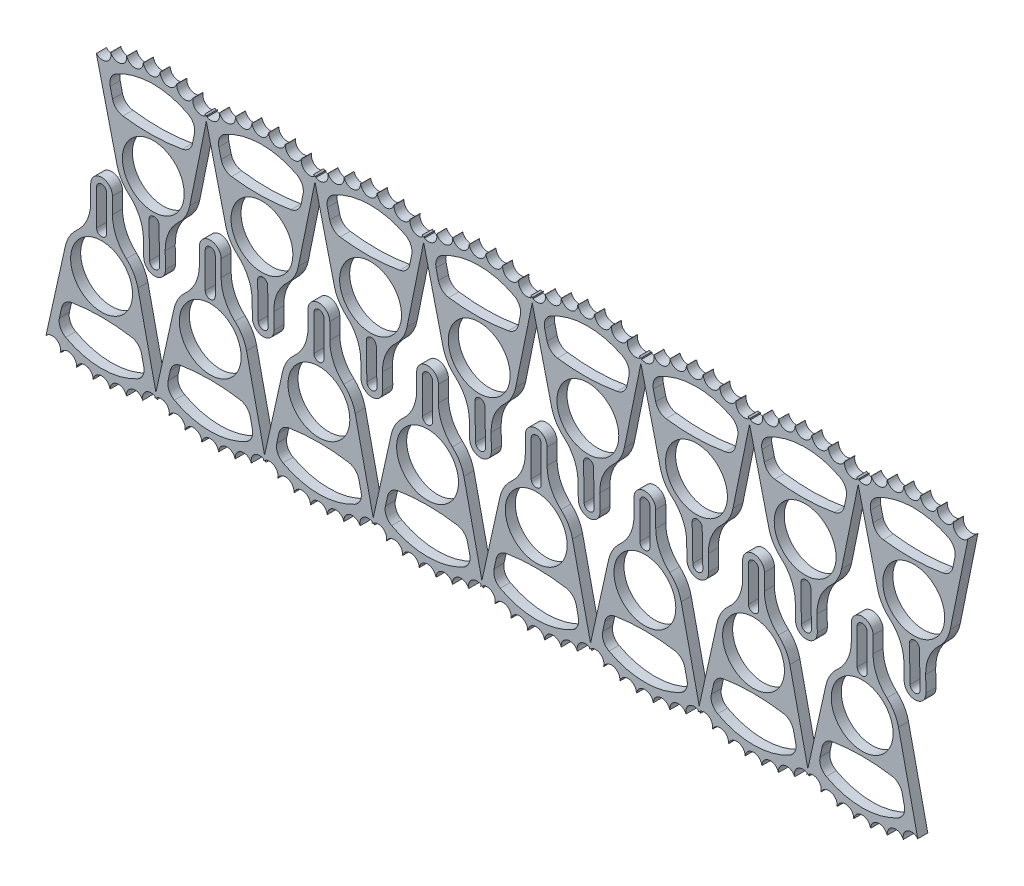
from build123d import *

# Parameters (mm, degrees)
STOCK_SHUFFLER_NONCOMPLINAT_1_OUTLINE_R = 7.4
STOCK_SHUFFLER_NONCOMPLINAT_1_DEPTH     = 2.4
MOVE_FACE1_BY                           = 0.100000054
MOVE_FACE1_2_BY                         = 0.100000054
MOVE_FACE1_3_BY                         = 0.100000054
MOVE_FACE1_4_BY                         = 0.100000054
LPATTERN1_COUNT                         = 8
LPATTERN1_PITCH                         = 26
BODY_MOVE_COPY3_OUTLINE_R               = 7.4
BODY_MOVE_COPY3_DEPTH                   = 2.4


# Read off the part's stored shape, not the designer's step: Stock-shuffler-noncomplinat-1, Body-Move/Copy3
with BuildPart() as part:
    # Stock-shuffler-noncomplinat-1 outline → Stock-shuffler-noncomplinat-1 (new body)
    with BuildSketch(Plane.XY):
        with BuildLine():
            ThreePointArc((-9.871608192, -24.979337297), (-9.849515256, -24.987026118), (-9.827416332, -24.994697709))
            ThreePointArc((-9.827416332, -24.994697709), (-7.457043369, -23.846185471), (-6.003959241, -26.043068459))
            ThreePointArc((-6.003959241, -26.043068459), (-5.981038032, -26.047741139), (-5.958113187, -26.052395944))
            ThreePointArc((-5.958113187, -26.052395944), (-3.762151626, -24.597919693), (-2.028971292, -26.581309285))
            ThreePointArc((-2.028971292, -26.581309285), (-2.005631596, -26.582882285), (-1.98229068, -26.584437086))
            ThreePointArc((-1.98229068, -26.584437086), (0, -24.85), (1.98229068, -26.584437086))
            ThreePointArc((1.98229068, -26.584437086), (2.005631596, -26.582882285), (2.028971292, -26.581309285))
            ThreePointArc((2.028971292, -26.581309285), (3.762151626, -24.597919693), (5.958113187, -26.052395944))
            ThreePointArc((5.958113187, -26.052395944), (5.981038032, -26.047741139), (6.003959241, -26.043068459))
            ThreePointArc((6.003959241, -26.043068459), (7.457043369, -23.846185471), (9.827416332, -24.994697709))
            ThreePointArc((9.827416332, -24.994697709), (9.849515256, -24.987026118), (9.871608192, -24.979337297))
            ThreePointArc((9.871608192, -24.979337297), (10.849859661, -22.68939398), (13.301146704, -23.12758134))
            Line((13.301146704, -23.12758134), (8.689034463, -2.323687436))
            ThreePointArc((8.689034463, -2.323687436), (7.680703716, 0.246308533), (5.933333333, 2.383668333))
            ThreePointArc((5.933333333, 2.383668333), (3.471290708, 5.754745353), (2.6, 9.837228258))
            Line((2.6, 9.837228258), (2.6, 13.7))
            ThreePointArc((2.6, 13.7), (0, 16.3), (-2.6, 13.7))
            Line((-2.6, 13.7), (-2.6, 9.837228258))
            ThreePointArc((-2.6, 9.837228258), (-3.471290708, 5.754745353), (-5.933333333, 2.383668333))
            ThreePointArc((-5.933333333, 2.383668333), (-7.680703716, 0.246308533), (-8.689034463, -2.323687436))
            Line((-8.689034463, -2.323687436), (-13.301146704, -23.12758134))
            ThreePointArc((-13.301146704, -23.12758134), (-10.849859661, -22.68939398), (-9.871608192, -24.979337297))
        make_face()
        with BuildLine():
            ThreePointArc((8.592722836, -21.16660881), (0, -23.35), (-8.592722836, -21.16660881))
            ThreePointArc((-8.592722836, -21.16660881), (-9.890638155, -19.774253528), (-10.089490385, -17.8811885))
            Line((-10.089490385, -17.8811885), (-9.567963024, -15.5287306))
            ThreePointArc((-9.567963024, -15.5287306), (-8.696436249, -13.994642768), (-7.113294646, -13.215767259))
            ThreePointArc((-7.113294646, -13.215767259), (0, -12.65), (7.113294646, -13.215767259))
            ThreePointArc((7.113294646, -13.215767259), (8.696436249, -13.994642768), (9.567963024, -15.5287306))
            Line((9.567963024, -15.5287306), (10.089490385, -17.8811885))
            ThreePointArc((10.089490385, -17.8811885), (9.890638155, -19.774253528), (8.592722836, -21.16660881))
        make_face(mode=Mode.SUBTRACT)
        with Locations((0, -4.25)):
            Circle(STOCK_SHUFFLER_NONCOMPLINAT_1_OUTLINE_R, mode=Mode.SUBTRACT)
        with BuildLine():
            Line((1.1, 13.7), (1.1, 5.2))
            ThreePointArc((1.1, 5.2), (0, 4.1), (-1.1, 5.2))
            Line((-1.1, 5.2), (-1.1, 13.7))
            ThreePointArc((-1.1, 13.7), (0, 14.8), (1.1, 13.7))
        make_face(mode=Mode.SUBTRACT)
    extrude(amount=STOCK_SHUFFLER_NONCOMPLINAT_1_DEPTH)

    # Move Face1: a face moved inward by 0.1
    extrude(part.faces().sort_by_distance((-1.1, 9.45, 1.2))[0], amount=MOVE_FACE1_BY, dir=(-1, 0, 0), mode=Mode.SUBTRACT)

    # Move Face1 2: a curved face moved inward by 0.1
    add(Solid.thicken(part.faces().sort_by_distance((0, 4.1, 1.2))[0], -MOVE_FACE1_2_BY), mode=Mode.SUBTRACT)

    # Move Face1 3: a face moved inward by 0.1
    extrude(part.faces().sort_by_distance((1.1, 9.45, 1.2))[0], amount=MOVE_FACE1_3_BY, dir=(1, 0, 0), mode=Mode.SUBTRACT)

    # Move Face1 4: a curved face moved inward by 0.1
    add(Solid.thicken(part.faces().sort_by_distance((0, 14.8, 1.2))[0], -MOVE_FACE1_4_BY), mode=Mode.SUBTRACT)


with BuildPart() as lpattern1_1:
    # LPattern1: pattern copy
    add(part.part.moved(Location(Vector(1, 0, 0) * (1 * LPATTERN1_PITCH))))


with BuildPart() as lpattern1_2:
    # LPattern1: pattern copy
    add(part.part.moved(Location(Vector(1, 0, 0) * (2 * LPATTERN1_PITCH))))


with BuildPart() as lpattern1_3:
    # LPattern1: pattern copy
    add(part.part.moved(Location(Vector(1, 0, 0) * (3 * LPATTERN1_PITCH))))


with BuildPart() as lpattern1_4:
    # LPattern1: pattern copy
    add(part.part.moved(Location(Vector(1, 0, 0) * (4 * LPATTERN1_PITCH))))


with BuildPart() as lpattern1_5:
    # LPattern1: pattern copy
    add(part.part.moved(Location(Vector(1, 0, 0) * (5 * LPATTERN1_PITCH))))


with BuildPart() as lpattern1_6:
    # LPattern1: pattern copy
    add(part.part.moved(Location(Vector(1, 0, 0) * (6 * LPATTERN1_PITCH))))


with BuildPart() as lpattern1_7:
    # LPattern1: pattern copy
    add(part.part.moved(Location(Vector(1, 0, 0) * (7 * LPATTERN1_PITCH))))


with BuildPart() as lpattern1_4_1:
    add(lpattern1_4.part)

    # Combine1: union LPattern1_7, LPattern1_3, LPattern1_6, LPattern1_2, LPattern1_5, part, LPattern1_1
    add(lpattern1_7.part)
    add(lpattern1_3.part)
    add(lpattern1_6.part)
    add(lpattern1_2.part)
    add(lpattern1_5.part)
    add(part.part)
    add(lpattern1_1.part)


with BuildPart() as body_2:
    # Body-Move/Copy3 outline → Body-Move/Copy3 (new body)
    with BuildSketch(Plane.XY):
        with BuildLine():
            ThreePointArc((93.7825825, 14.646484503), (93.11781374, 12.524906754), (90.903216139, 12.328521635))
            Line((90.903216139, 12.328521635), (90.988085597, 12.745668346))
            ThreePointArc((90.988085597, 12.745668346), (90.847253182, 12.596250901), (90.691843418, 12.462060189))
            ThreePointArc((90.691843418, 12.462060189), (90.531845138, 12.590745433), (90.385883921, 12.735156877))
            Line((90.385883921, 12.735156877), (90.485259889, 12.321226181))
            ThreePointArc((90.485259889, 12.321226181), (88.265157619, 12.440203326), (87.526751822, 14.537288572))
            ThreePointArc((87.526751822, 14.537288572), (87.504528063, 14.544590647), (87.482298617, 14.55187539))
            ThreePointArc((87.482298617, 14.55187539), (85.132330976, 13.362169364), (83.641127265, 15.533357941))
            ThreePointArc((83.641127265, 15.533357941), (83.618127997, 15.537629878), (83.595125406, 15.541883881))
            ThreePointArc((83.595125406, 15.541883881), (81.424882411, 14.04930434), (79.657351128, 16.002143684))
            ThreePointArc((79.657351128, 16.002143684), (79.633987534, 16.003309112), (79.610623038, 16.00445632))
            ThreePointArc((79.610623038, 16.00445632), (77.658904371, 14.235687655), (75.646645503, 15.935264835))
            ThreePointArc((75.646645503, 15.935264835), (75.623335277, 15.933302916), (75.600026588, 15.931322821))
            ThreePointArc((75.600026588, 15.931322821), (73.901725147, 13.917987141), (71.680713931, 15.333917055))
            ThreePointArc((71.680713931, 15.333917055), (71.657873815, 15.328862865), (71.635037646, 15.323790867))
            ThreePointArc((71.635037646, 15.323790867), (70.220515725, 13.10188266), (67.830459479, 14.208851262))
            ThreePointArc((67.830459479, 14.208851262), (67.808497808, 14.20079516), (67.786542426, 14.192721935))
            ThreePointArc((67.786542426, 14.192721935), (67.121773666, 12.071144186), (64.907176065, 11.874759067))
            Line((64.907176065, 11.874759067), (64.992045523, 12.291905779))
            ThreePointArc((64.992045523, 12.291905779), (64.851213108, 12.142488334), (64.695803344, 12.008297622))
            ThreePointArc((64.695803344, 12.008297622), (64.535805064, 12.136982866), (64.389843847, 12.281394309))
            Line((64.389843847, 12.281394309), (64.489219815, 11.867463614))
            ThreePointArc((64.489219815, 11.867463614), (62.269117545, 11.986440759), (61.530711748, 14.083526005))
            ThreePointArc((61.530711748, 14.083526005), (61.508487989, 14.090828079), (61.486258543, 14.098112823))
            ThreePointArc((61.486258543, 14.098112823), (59.136290902, 12.908406796), (57.645087191, 15.079595373))
            ThreePointArc((57.645087191, 15.079595373), (57.622087924, 15.083867311), (57.599085332, 15.088121314))
            ThreePointArc((57.599085332, 15.088121314), (55.428842337, 13.595541772), (53.661311054, 15.548381117))
            ThreePointArc((53.661311054, 15.548381117), (53.637947459, 15.549546544), (53.614582963, 15.550693753))
            ThreePointArc((53.614582963, 15.550693753), (51.662864297, 13.781925087), (49.650605429, 15.481502268))
            ThreePointArc((49.650605429, 15.481502268), (49.627295203, 15.479540349), (49.603986514, 15.477560254))
            ThreePointArc((49.603986514, 15.477560254), (47.905685073, 13.464224574), (45.684673857, 14.880154488))
            ThreePointArc((45.684673857, 14.880154488), (45.66183374, 14.875100298), (45.638997572, 14.870028299))
            ThreePointArc((45.638997572, 14.870028299), (44.224475651, 12.648120093), (41.834419405, 13.755088695))
            ThreePointArc((41.834419405, 13.755088695), (41.812457734, 13.747032592), (41.790502352, 13.738959368))
            ThreePointArc((41.790502352, 13.738959368), (41.125733592, 11.617381619), (38.911135991, 11.4209965))
            Line((38.911135991, 11.4209965), (38.996005449, 11.838143211))
            ThreePointArc((38.996005449, 11.838143211), (38.855173034, 11.688725766), (38.69976327, 11.554535054))
            ThreePointArc((38.69976327, 11.554535054), (38.539764989, 11.683220298), (38.393803773, 11.827631742))
            Line((38.393803773, 11.827631742), (38.49317974, 11.413701046))
            ThreePointArc((38.49317974, 11.413701046), (36.273077471, 11.532678191), (35.534671674, 13.629763437))
            ThreePointArc((35.534671674, 13.629763437), (35.512447915, 13.637065512), (35.490218469, 13.644350255))
            ThreePointArc((35.490218469, 13.644350255), (33.140250828, 12.454644229), (31.649047117, 14.625832806))
            ThreePointArc((31.649047117, 14.625832806), (31.62604785, 14.630104744), (31.603045258, 14.634358746))
            ThreePointArc((31.603045258, 14.634358746), (29.432802263, 13.141779205), (27.665270979, 15.09461855))
            ThreePointArc((27.665270979, 15.09461855), (27.641907385, 15.095783977), (27.618542889, 15.096931186))
            ThreePointArc((27.618542889, 15.096931186), (25.666824223, 13.32816252), (23.654565355, 15.0277397))
            ThreePointArc((23.654565355, 15.0277397), (23.631255129, 15.025777781), (23.60794644, 15.023797686))
            ThreePointArc((23.60794644, 15.023797686), (21.909644999, 13.010462007), (19.688633783, 14.42639192))
            ThreePointArc((19.688633783, 14.42639192), (19.665793667, 14.42133773), (19.642957498, 14.416265732))
            ThreePointArc((19.642957498, 14.416265732), (18.228435577, 12.194357525), (15.838379331, 13.301326127))
            ThreePointArc((15.838379331, 13.301326127), (15.81641766, 13.293270025), (15.794462278, 13.2851968))
            ThreePointArc((15.794462278, 13.2851968), (15.129693518, 11.163619051), (12.915095917, 10.967233932))
            Line((12.915095917, 10.967233932), (12.999965375, 11.384380644))
            ThreePointArc((12.999965375, 11.384380644), (12.85913296, 11.234963199), (12.703723196, 11.100772487))
            ThreePointArc((12.703723196, 11.100772487), (12.543724915, 11.229457731), (12.397763699, 11.373869175))
            Line((12.397763699, 11.373869175), (12.497139666, 10.959938479))
            ThreePointArc((12.497139666, 10.959938479), (10.277037397, 11.078915624), (9.5386316, 13.17600087))
            ThreePointArc((9.5386316, 13.17600087), (9.516407841, 13.183302944), (9.494178395, 13.190587688))
            ThreePointArc((9.494178395, 13.190587688), (7.144210754, 12.000881661), (5.653007043, 14.172070238))
            ThreePointArc((5.653007043, 14.172070238), (5.630007776, 14.176342176), (5.607005184, 14.180596179))
            ThreePointArc((5.607005184, 14.180596179), (3.436762189, 12.688016638), (1.669230905, 14.640855982))
            ThreePointArc((1.669230905, 14.640855982), (1.645867311, 14.642021409), (1.622502815, 14.643168618))
            ThreePointArc((1.622502815, 14.643168618), (-0.329215851, 12.874399953), (-2.341474719, 14.573977133))
            ThreePointArc((-2.341474719, 14.573977133), (-2.364784945, 14.572015214), (-2.388093634, 14.570035119))
            ThreePointArc((-2.388093634, 14.570035119), (-4.086395075, 12.556699439), (-6.307406291, 13.972629353))
            ThreePointArc((-6.307406291, 13.972629353), (-6.330246407, 13.967575163), (-6.353082576, 13.962503165))
            ThreePointArc((-6.353082576, 13.962503165), (-7.767604497, 11.740594958), (-10.157660743, 12.84756356))
            ThreePointArc((-10.157660743, 12.84756356), (-10.179622414, 12.839507458), (-10.201577796, 12.831434233))
            ThreePointArc((-10.201577796, 12.831434233), (-11.139715251, 10.524766843), (-13.598276375, 10.920106607))
            Line((-13.598276375, 10.920106607), (-8.62378857, -9.800126306))
            ThreePointArc((-8.62378857, -9.800126306), (-7.570758782, -12.352133054), (-5.78635246, -14.458671506))
            ThreePointArc((-5.78635246, -14.458671506), (-3.26585141, -17.786266526), (-2.323444253, -21.852921529))
            Line((-2.323444253, -21.852921529), (-2.25602959, -25.715104952))
            ThreePointArc((-2.25602959, -25.715104952), (0.388950674, -28.269332703), (2.943178425, -25.624352439))
            Line((2.943178425, -25.624352439), (2.875763762, -21.762169016))
            ThreePointArc((2.875763762, -21.762169016), (3.675672618, -17.665101774), (6.078506856, -14.251569616))
            ThreePointArc((6.078506856, -14.251569616), (7.788309034, -12.084039528), (8.751633593, -9.496837184))
            Line((8.751633593, -9.496837184), (12.722571624, 10.020946799))
            Line((12.722571624, 10.020946799), (17.372251504, -9.346363738))
            ThreePointArc((17.372251504, -9.346363738), (18.425281292, -11.898370486), (20.209687614, -14.004908938))
            ThreePointArc((20.209687614, -14.004908938), (22.730188664, -17.332503959), (23.672595822, -21.399158962))
            Line((23.672595822, -21.399158962), (23.740010484, -25.261342385))
            ThreePointArc((23.740010484, -25.261342385), (26.384990749, -27.815570136), (28.939218499, -25.170589871))
            Line((28.939218499, -25.170589871), (28.871803836, -21.308406449))
            ThreePointArc((28.871803836, -21.308406449), (29.671712692, -17.211339207), (32.07454693, -13.797807049))
            ThreePointArc((32.07454693, -13.797807049), (33.784349108, -11.63027696), (34.747673667, -9.043074616))
            Line((34.747673667, -9.043074616), (38.718611698, 10.474709366))
            Line((38.718611698, 10.474709366), (43.368291578, -8.892601171))
            ThreePointArc((43.368291578, -8.892601171), (44.421321366, -11.444607919), (46.205727688, -13.551146371))
            ThreePointArc((46.205727688, -13.551146371), (48.726228738, -16.878741392), (49.668635896, -20.945396395))
            Line((49.668635896, -20.945396395), (49.736050558, -24.807579818))
            ThreePointArc((49.736050558, -24.807579818), (52.381030822, -27.361807568), (54.935258573, -24.716827304))
            Line((54.935258573, -24.716827304), (54.86784391, -20.854643881))
            ThreePointArc((54.86784391, -20.854643881), (55.667752766, -16.757576639), (58.070587004, -13.344044481))
            ThreePointArc((58.070587004, -13.344044481), (59.780389182, -11.176514393), (60.743713741, -8.589312049))
            Line((60.743713741, -8.589312049), (64.714651772, 10.928471934))
            Line((64.714651772, 10.928471934), (69.364331652, -8.438838604))
            ThreePointArc((69.364331652, -8.438838604), (70.41736144, -10.990845351), (72.201767762, -13.097383804))
            ThreePointArc((72.201767762, -13.097383804), (74.722268812, -16.424978824), (75.66467597, -20.491633827))
            Line((75.66467597, -20.491633827), (75.732090632, -24.35381725))
            ThreePointArc((75.732090632, -24.35381725), (78.377070896, -26.908045001), (80.931298647, -24.263064737))
            Line((80.931298647, -24.263064737), (80.863883984, -20.400881314))
            ThreePointArc((80.863883984, -20.400881314), (81.66379284, -16.303814072), (84.066627078, -12.890281914))
            ThreePointArc((84.066627078, -12.890281914), (85.776429256, -10.722751825), (86.739753815, -8.135549482))
            Line((86.739753815, -8.135549482), (90.710691846, 11.382234501))
            Line((90.710691846, 11.382234501), (95.360371726, -7.985076036))
            ThreePointArc((95.360371726, -7.985076036), (96.413401514, -10.537082784), (98.197807836, -12.643621236))
            ThreePointArc((98.197807836, -12.643621236), (100.718308886, -15.971216257), (101.660716044, -20.03787126))
            Line((101.660716044, -20.03787126), (101.728130706, -23.900054683))
            ThreePointArc((101.728130706, -23.900054683), (104.37311097, -26.454282433), (106.927338721, -23.809302169))
            Line((106.927338721, -23.809302169), (106.859924059, -19.947118746))
            ThreePointArc((106.859924059, -19.947118746), (107.659832914, -15.850051504), (110.062667152, -12.436519347))
            ThreePointArc((110.062667152, -12.436519347), (111.77246933, -10.268989258), (112.735793889, -7.681786914))
            Line((112.735793889, -7.681786914), (116.70673192, 11.835997068))
            Line((116.70673192, 11.835997068), (121.356411801, -7.531313469))
            ThreePointArc((121.356411801, -7.531313469), (122.409441588, -10.083320217), (124.19384791, -12.189858669))
            ThreePointArc((124.19384791, -12.189858669), (126.71434896, -15.517453689), (127.656756118, -19.584108692))
            Line((127.656756118, -19.584108692), (127.72417078, -23.446292115))
            ThreePointArc((127.72417078, -23.446292115), (130.369151044, -26.000519866), (132.923378795, -23.355539602))
            Line((132.923378795, -23.355539602), (132.855964133, -19.493356179))
            ThreePointArc((132.855964133, -19.493356179), (133.655872988, -15.396288937), (136.058707226, -11.982756779))
            ThreePointArc((136.058707226, -11.982756779), (137.768509404, -9.815226691), (138.731833963, -7.228024347))
            Line((138.731833963, -7.228024347), (142.702771994, 12.289759636))
            Line((142.702771994, 12.289759636), (147.352451875, -7.077550901))
            ThreePointArc((147.352451875, -7.077550901), (148.405481662, -9.629557649), (150.189887984, -11.736096101))
            ThreePointArc((150.189887984, -11.736096101), (152.710389034, -15.063691122), (153.652796192, -19.130346125))
            Line((153.652796192, -19.130346125), (153.720210854, -22.992529548))
            ThreePointArc((153.720210854, -22.992529548), (156.365191119, -25.546757299), (158.919418869, -22.901777034))
            Line((158.919418869, -22.901777034), (158.852004207, -19.039593612))
            ThreePointArc((158.852004207, -19.039593612), (159.651913062, -14.942526369), (162.0547473, -11.528994212))
            ThreePointArc((162.0547473, -11.528994212), (163.764549478, -9.361464123), (164.727874037, -6.774261779))
            Line((164.727874037, -6.774261779), (168.698812068, 12.743522203))
            Line((168.698812068, 12.743522203), (173.348491949, -6.623788334))
            ThreePointArc((173.348491949, -6.623788334), (174.401521736, -9.175795082), (176.185928058, -11.282333534))
            ThreePointArc((176.185928058, -11.282333534), (178.706429109, -14.609928555), (179.648836266, -18.676583558))
            Line((179.648836266, -18.676583558), (179.716250928, -22.538766981))
            ThreePointArc((179.716250928, -22.538766981), (182.361231192, -25.092994731), (184.915458943, -22.448014467))
            Line((184.915458943, -22.448014467), (184.848044281, -18.585831044))
            ThreePointArc((184.848044281, -18.585831044), (185.647953136, -14.488763802), (188.050787374, -11.075231644))
            ThreePointArc((188.050787374, -11.075231644), (189.760589552, -8.907701556), (190.723914111, -6.320499212))
            Line((190.723914111, -6.320499212), (194.972245893, 14.560718616))
            ThreePointArc((194.972245893, 14.560718616), (192.528979616, 14.079817136), (191.510912118, 16.352338841))
            ThreePointArc((191.510912118, 16.352338841), (191.48868836, 16.359640916), (191.466458914, 16.36692566))
            ThreePointArc((191.466458914, 16.36692566), (189.116491273, 15.177219633), (187.625287561, 17.34840821))
            ThreePointArc((187.625287561, 17.34840821), (187.602288294, 17.352680148), (187.579285702, 17.356934151))
            ThreePointArc((187.579285702, 17.356934151), (185.409042707, 15.864354609), (183.641511424, 17.817193954))
            ThreePointArc((183.641511424, 17.817193954), (183.61814783, 17.818359381), (183.594783334, 17.81950659))
            ThreePointArc((183.594783334, 17.81950659), (181.643064667, 16.050737924), (179.630805799, 17.750315105))
            ThreePointArc((179.630805799, 17.750315105), (179.607495574, 17.748353186), (179.584186885, 17.746373091))
            ThreePointArc((179.584186885, 17.746373091), (177.885885444, 15.733037411), (175.664874227, 17.148967325))
            ThreePointArc((175.664874227, 17.148967325), (175.642034111, 17.143913135), (175.619197943, 17.138841136))
            ThreePointArc((175.619197943, 17.138841136), (174.204676021, 14.91693293), (171.814619775, 16.023901531))
            ThreePointArc((171.814619775, 16.023901531), (171.792658104, 16.015845429), (171.770702722, 16.007772205))
            ThreePointArc((171.770702722, 16.007772205), (171.105933962, 13.886194456), (168.891336361, 13.689809337))
            Line((168.891336361, 13.689809337), (168.976205819, 14.106956048))
            ThreePointArc((168.976205819, 14.106956048), (168.835373405, 13.957538603), (168.679963641, 13.823347891))
            ThreePointArc((168.679963641, 13.823347891), (168.51996536, 13.952033135), (168.374004143, 14.096444579))
            Line((168.374004143, 14.096444579), (168.473380111, 13.682513883))
            ThreePointArc((168.473380111, 13.682513883), (166.253277841, 13.801491028), (165.514872044, 15.898576274))
            ThreePointArc((165.514872044, 15.898576274), (165.492648286, 15.905878349), (165.47041884, 15.913163092))
            ThreePointArc((165.47041884, 15.913163092), (163.120451198, 14.723457066), (161.629247487, 16.894645643))
            ThreePointArc((161.629247487, 16.894645643), (161.60624822, 16.898917581), (161.583245628, 16.903171583))
            ThreePointArc((161.583245628, 16.903171583), (159.413002633, 15.410592042), (157.64547135, 17.363431387))
            ThreePointArc((157.64547135, 17.363431387), (157.622107756, 17.364596814), (157.59874326, 17.365744023))
            ThreePointArc((157.59874326, 17.365744023), (155.647024594, 15.596975357), (153.634765725, 17.296552537))
            ThreePointArc((153.634765725, 17.296552537), (153.6114555, 17.294590618), (153.588146811, 17.292610523))
            ThreePointArc((153.588146811, 17.292610523), (151.88984537, 15.279274843), (149.668834153, 16.695204757))
            ThreePointArc((149.668834153, 16.695204757), (149.645994037, 16.690150567), (149.623157868, 16.685078569))
            ThreePointArc((149.623157868, 16.685078569), (148.208635947, 14.463170362), (145.818579701, 15.570138964))
            ThreePointArc((145.818579701, 15.570138964), (145.79661803, 15.562082862), (145.774662648, 15.554009637))
            ThreePointArc((145.774662648, 15.554009637), (145.109893888, 13.432431888), (142.895296287, 13.236046769))
            Line((142.895296287, 13.236046769), (142.980165745, 13.653193481))
            ThreePointArc((142.980165745, 13.653193481), (142.839333331, 13.503776036), (142.683923567, 13.369585324))
            ThreePointArc((142.683923567, 13.369585324), (142.523925286, 13.498270568), (142.377964069, 13.642682012))
            Line((142.377964069, 13.642682012), (142.477340037, 13.228751316))
            ThreePointArc((142.477340037, 13.228751316), (140.257237767, 13.347728461), (139.51883197, 15.444813707))
            ThreePointArc((139.51883197, 15.444813707), (139.496608211, 15.452115781), (139.474378765, 15.459400525))
            ThreePointArc((139.474378765, 15.459400525), (137.124411124, 14.269694498), (135.633207413, 16.440883075))
            ThreePointArc((135.633207413, 16.440883075), (135.610208146, 16.445155013), (135.587205554, 16.449409016))
            ThreePointArc((135.587205554, 16.449409016), (133.416962559, 14.956829475), (131.649431276, 16.909668819))
            ThreePointArc((131.649431276, 16.909668819), (131.626067682, 16.910834246), (131.602703186, 16.911981455))
            ThreePointArc((131.602703186, 16.911981455), (129.650984519, 15.14321279), (127.638725651, 16.84278997))
            ThreePointArc((127.638725651, 16.84278997), (127.615415426, 16.840828051), (127.592106737, 16.838847956))
            ThreePointArc((127.592106737, 16.838847956), (125.893805296, 14.825512276), (123.672794079, 16.24144219))
            ThreePointArc((123.672794079, 16.24144219), (123.649953962, 16.236388), (123.627117794, 16.231316001))
            ThreePointArc((123.627117794, 16.231316001), (122.212595873, 14.009407795), (119.822539627, 15.116376397))
            ThreePointArc((119.822539627, 15.116376397), (119.800577956, 15.108320294), (119.778622574, 15.10024707))
            ThreePointArc((119.778622574, 15.10024707), (119.113853814, 12.978669321), (116.899256213, 12.782284202))
            Line((116.899256213, 12.782284202), (116.984125671, 13.199430913))
            ThreePointArc((116.984125671, 13.199430913), (116.843293257, 13.050013469), (116.687883493, 12.915822757))
            ThreePointArc((116.687883493, 12.915822757), (116.527885212, 13.044508001), (116.381923995, 13.188919444))
            Line((116.381923995, 13.188919444), (116.481299963, 12.774988748))
            ThreePointArc((116.481299963, 12.774988748), (114.261197693, 12.893965893), (113.522791896, 14.991051139))
            ThreePointArc((113.522791896, 14.991051139), (113.500568137, 14.998353214), (113.478338691, 15.005637957))
            ThreePointArc((113.478338691, 15.005637957), (111.12837105, 13.815931931), (109.637167339, 15.987120508))
            ThreePointArc((109.637167339, 15.987120508), (109.614168072, 15.991392446), (109.59116548, 15.995646449))
            ThreePointArc((109.59116548, 15.995646449), (107.420922485, 14.503066907), (105.653391202, 16.455906252))
            ThreePointArc((105.653391202, 16.455906252), (105.630027608, 16.457071679), (105.606663112, 16.458218888))
            ThreePointArc((105.606663112, 16.458218888), (103.654944445, 14.689450222), (101.642685577, 16.389027403))
            ThreePointArc((101.642685577, 16.389027403), (101.619375351, 16.387065483), (101.596066662, 16.385085389))
            ThreePointArc((101.596066662, 16.385085389), (99.897765221, 14.371749709), (97.676754005, 15.787679623))
            ThreePointArc((97.676754005, 15.787679623), (97.653913889, 15.782625432), (97.63107772, 15.777553434))
            ThreePointArc((97.63107772, 15.777553434), (96.216555799, 13.555645228), (93.826499553, 14.662613829))
            ThreePointArc((93.826499553, 14.662613829), (93.804537882, 14.654557727), (93.7825825, 14.646484503))
        make_face()
        with BuildLine():
            Line((-0.856242871, -25.690671584), (-1.004588326, -17.191966175))
            ThreePointArc((-1.004588326, -17.191966175), (0.174286074, -15.971205999), (1.395046251, -17.150080398))
            Line((1.395046251, -17.150080398), (1.543391705, -25.648785807))
            ThreePointArc((1.543391705, -25.648785807), (0.364517306, -26.869545984), (-0.856242871, -25.690671584))
        make_face(mode=Mode.SUBTRACT)
        with BuildLine():
            Line((25.139797203, -25.236909017), (24.991451748, -16.738203608))
            ThreePointArc((24.991451748, -16.738203608), (26.170326148, -15.517443431), (27.391086325, -16.696317831))
            Line((27.391086325, -16.696317831), (27.53943178, -25.19502324))
            ThreePointArc((27.53943178, -25.19502324), (26.36055738, -26.415783416), (25.139797203, -25.236909017))
        make_face(mode=Mode.SUBTRACT)
        with BuildLine():
            Line((51.135837277, -24.783146449), (50.987491823, -16.284441041))
            ThreePointArc((50.987491823, -16.284441041), (52.166366222, -15.063680864), (53.387126399, -16.242555263))
            Line((53.387126399, -16.242555263), (53.535471854, -24.741260672))
            ThreePointArc((53.535471854, -24.741260672), (52.356597454, -25.962020849), (51.135837277, -24.783146449))
        make_face(mode=Mode.SUBTRACT)
        with BuildLine():
            Line((77.131877351, -24.329383882), (76.983531897, -15.830678473))
            ThreePointArc((76.983531897, -15.830678473), (78.162406296, -14.609918296), (79.383166473, -15.788792696))
            Line((79.383166473, -15.788792696), (79.531511928, -24.287498105))
            ThreePointArc((79.531511928, -24.287498105), (78.352637528, -25.508258282), (77.131877351, -24.329383882))
        make_face(mode=Mode.SUBTRACT)
        with Locations((0.030303722, -7.722462568)):
            Circle(BODY_MOVE_COPY3_OUTLINE_R, mode=Mode.SUBTRACT)
        with Locations((26.026343796, -7.2687)):
            Circle(BODY_MOVE_COPY3_OUTLINE_R, mode=Mode.SUBTRACT)
        with Locations((52.02238387, -6.814937433)):
            Circle(BODY_MOVE_COPY3_OUTLINE_R, mode=Mode.SUBTRACT)
        with Locations((78.018423944, -6.361174865)):
            Circle(BODY_MOVE_COPY3_OUTLINE_R, mode=Mode.SUBTRACT)
        with BuildLine():
            Line((103.127917425, -23.875621315), (102.979571971, -15.376915906))
            ThreePointArc((102.979571971, -15.376915906), (104.15844637, -14.156155729), (105.379206547, -15.335030129))
            Line((105.379206547, -15.335030129), (105.527552002, -23.833735537))
            ThreePointArc((105.527552002, -23.833735537), (104.348677602, -25.054495714), (103.127917425, -23.875621315))
        make_face(mode=Mode.SUBTRACT)
        with BuildLine():
            Line((129.123957499, -23.421858747), (128.975612045, -14.923153338))
            ThreePointArc((128.975612045, -14.923153338), (130.154486445, -13.702393162), (131.375246621, -14.881267561))
            Line((131.375246621, -14.881267561), (131.523592076, -23.37997297))
            ThreePointArc((131.523592076, -23.37997297), (130.344717676, -24.600733147), (129.123957499, -23.421858747))
        make_face(mode=Mode.SUBTRACT)
        with BuildLine():
            Line((155.119997574, -22.96809618), (154.971652119, -14.469390771))
            ThreePointArc((154.971652119, -14.469390771), (156.150526518, -13.248630594), (157.371286695, -14.427504994))
            Line((157.371286695, -14.427504994), (157.51963215, -22.926210403))
            ThreePointArc((157.51963215, -22.926210403), (156.34075775, -24.146970579), (155.119997574, -22.96809618))
        make_face(mode=Mode.SUBTRACT)
        with BuildLine():
            Line((181.116037648, -22.514333613), (180.967692193, -14.015628204))
            ThreePointArc((180.967692193, -14.015628204), (182.146566592, -12.794868027), (183.367326769, -13.973742426))
            Line((183.367326769, -13.973742426), (183.515672224, -22.472447835))
            ThreePointArc((183.515672224, -22.472447835), (182.336797825, -23.693208012), (181.116037648, -22.514333613))
        make_face(mode=Mode.SUBTRACT)
        with Locations((104.014464018, -5.907412298)):
            Circle(BODY_MOVE_COPY3_OUTLINE_R, mode=Mode.SUBTRACT)
        with Locations((130.010504092, -5.453649731)):
            Circle(BODY_MOVE_COPY3_OUTLINE_R, mode=Mode.SUBTRACT)
        with BuildLine():
            ThreePointArc((-8.856345934, 9.04160607), (-0.303037241, 11.37462841), (8.326482312, 9.341533453))
            ThreePointArc((8.326482312, 9.341533453), (9.648499903, 7.972041979), (9.880360386, 6.082735724))
            Line((9.880360386, 6.082735724), (9.399968508, 3.721534207))
            ThreePointArc((9.399968508, 3.721534207), (8.555347995, 2.172469784), (6.986040764, 1.366083271))
            ThreePointArc((6.986040764, 1.366083271), (-0.116296492, 0.676258072), (-7.238381749, 1.117795052))
            ThreePointArc((-7.238381749, 1.117795052), (-8.834875484, 1.868922304), (-9.733043046, 3.387566248))
            Line((-9.733043046, 3.387566248), (-10.295547027, 5.73056395))
            ThreePointArc((-10.295547027, 5.73056395), (-10.129763624, 7.626811104), (-8.856345934, 9.04160607))
        make_face(mode=Mode.SUBTRACT)
        with BuildLine():
            ThreePointArc((17.139694141, 9.495368638), (25.693002833, 11.828390977), (34.322522386, 9.79529602))
            ThreePointArc((34.322522386, 9.79529602), (35.644539977, 8.425804546), (35.87640046, 6.536498291))
            Line((35.87640046, 6.536498291), (35.396008582, 4.175296774))
            ThreePointArc((35.396008582, 4.175296774), (34.551388069, 2.626232352), (32.982080838, 1.819845838))
            ThreePointArc((32.982080838, 1.819845838), (25.879743582, 1.130020639), (18.757658325, 1.57155762))
            ThreePointArc((18.757658325, 1.57155762), (17.16116459, 2.322684872), (16.262997028, 3.841328815))
            Line((16.262997028, 3.841328815), (15.700493047, 6.184326517))
            ThreePointArc((15.700493047, 6.184326517), (15.86627645, 8.080573672), (17.139694141, 9.495368638))
        make_face(mode=Mode.SUBTRACT)
        with BuildLine():
            ThreePointArc((43.135734215, 9.949131205), (51.689042907, 12.282153545), (60.31856246, 10.249058588))
            ThreePointArc((60.31856246, 10.249058588), (61.640580051, 8.879567113), (61.872440534, 6.990260858))
            Line((61.872440534, 6.990260858), (61.392048656, 4.629059341))
            ThreePointArc((61.392048656, 4.629059341), (60.547428143, 3.079994919), (58.978120912, 2.273608406))
            ThreePointArc((58.978120912, 2.273608406), (51.875783656, 1.583783207), (44.753698399, 2.025320187))
            ThreePointArc((44.753698399, 2.025320187), (43.157204664, 2.776447439), (42.259037102, 4.295091382))
            Line((42.259037102, 4.295091382), (41.696533121, 6.638089085))
            ThreePointArc((41.696533121, 6.638089085), (41.862316524, 8.53433624), (43.135734215, 9.949131205))
        make_face(mode=Mode.SUBTRACT)
        with BuildLine():
            ThreePointArc((69.131774289, 10.402893772), (77.685082981, 12.735916112), (86.314602534, 10.702821155))
            ThreePointArc((86.314602534, 10.702821155), (87.636620125, 9.333329681), (87.868480608, 7.444023426))
            Line((87.868480608, 7.444023426), (87.38808873, 5.082821909))
            ThreePointArc((87.38808873, 5.082821909), (86.543468217, 3.533757486), (84.974160986, 2.727370973))
            ThreePointArc((84.974160986, 2.727370973), (77.87182373, 2.037545774), (70.749738473, 2.479082755))
            ThreePointArc((70.749738473, 2.479082755), (69.153244738, 3.230210007), (68.255077176, 4.74885395))
            Line((68.255077176, 4.74885395), (67.692573196, 7.091851652))
            ThreePointArc((67.692573196, 7.091851652), (67.858356599, 8.988098807), (69.131774289, 10.402893772))
        make_face(mode=Mode.SUBTRACT)
        with Locations((156.006544166, -4.999887163)):
            Circle(BODY_MOVE_COPY3_OUTLINE_R, mode=Mode.SUBTRACT)
        with Locations((182.00258424, -4.546124596)):
            Circle(BODY_MOVE_COPY3_OUTLINE_R, mode=Mode.SUBTRACT)
        with BuildLine():
            ThreePointArc((95.127814363, 10.85665634), (103.681123055, 13.18967868), (112.310642608, 11.156583722))
            ThreePointArc((112.310642608, 11.156583722), (113.632660199, 9.787092248), (113.864520683, 7.897785993))
            Line((113.864520683, 7.897785993), (113.384128805, 5.536584476))
            ThreePointArc((113.384128805, 5.536584476), (112.539508292, 3.987520054), (110.97020106, 3.181133541))
            ThreePointArc((110.97020106, 3.181133541), (103.867863804, 2.491308341), (96.745778547, 2.932845322))
            ThreePointArc((96.745778547, 2.932845322), (95.149284812, 3.683972574), (94.25111725, 5.202616517))
            Line((94.25111725, 5.202616517), (93.68861327, 7.545614219))
            ThreePointArc((93.68861327, 7.545614219), (93.854396673, 9.441861374), (95.127814363, 10.85665634))
        make_face(mode=Mode.SUBTRACT)
        with BuildLine():
            ThreePointArc((121.123854437, 11.310418907), (129.677163129, 13.643441247), (138.306682682, 11.61034629))
            ThreePointArc((138.306682682, 11.61034629), (139.628700273, 10.240854816), (139.860560757, 8.351548561))
            Line((139.860560757, 8.351548561), (139.380168879, 5.990347044))
            ThreePointArc((139.380168879, 5.990347044), (138.535548366, 4.441282621), (136.966241134, 3.634896108))
            ThreePointArc((136.966241134, 3.634896108), (129.863903878, 2.945070909), (122.741818621, 3.386607889))
            ThreePointArc((122.741818621, 3.386607889), (121.145324886, 4.137735141), (120.247157324, 5.656379085))
            Line((120.247157324, 5.656379085), (119.684653344, 7.999376787))
            ThreePointArc((119.684653344, 7.999376787), (119.850436747, 9.895623941), (121.123854437, 11.310418907))
        make_face(mode=Mode.SUBTRACT)
        with BuildLine():
            ThreePointArc((147.119894511, 11.764181474), (155.673203203, 14.097203814), (164.302722756, 12.064108857))
            ThreePointArc((164.302722756, 12.064108857), (165.624740347, 10.694617383), (165.856600831, 8.805311128))
            Line((165.856600831, 8.805311128), (165.376208953, 6.444109611))
            ThreePointArc((165.376208953, 6.444109611), (164.53158844, 4.895045189), (162.962281209, 4.088658675))
            ThreePointArc((162.962281209, 4.088658675), (155.859943952, 3.398833476), (148.737858695, 3.840370457))
            ThreePointArc((148.737858695, 3.840370457), (147.14136496, 4.591497709), (146.243197399, 6.110141652))
            Line((146.243197399, 6.110141652), (145.680693418, 8.453139354))
            ThreePointArc((145.680693418, 8.453139354), (145.846476821, 10.349386509), (147.119894511, 11.764181474))
        make_face(mode=Mode.SUBTRACT)
        with BuildLine():
            ThreePointArc((173.115934585, 12.217944042), (181.669243277, 14.550966382), (190.29876283, 12.517871425))
            ThreePointArc((190.29876283, 12.517871425), (191.620780421, 11.14837995), (191.852640905, 9.259073695))
            Line((191.852640905, 9.259073695), (191.372249027, 6.897872178))
            ThreePointArc((191.372249027, 6.897872178), (190.527628514, 5.348807756), (188.958321283, 4.542421243))
            ThreePointArc((188.958321283, 4.542421243), (181.855984026, 3.852596044), (174.733898769, 4.294133024))
            ThreePointArc((174.733898769, 4.294133024), (173.137405034, 5.045260276), (172.239237473, 6.563904219))
            Line((172.239237473, 6.563904219), (171.676733492, 8.906901921))
            ThreePointArc((171.676733492, 8.906901921), (171.842516895, 10.803149076), (173.115934585, 12.217944042))
        make_face(mode=Mode.SUBTRACT)
    extrude(amount=BODY_MOVE_COPY3_DEPTH)


with BuildPart() as body_2_1:
    # Body-Move/Copy4: moved
    add(body_2.part.moved(Location((12.343022647, 30.433054973, 0))))


solid = Compound([lpattern1_4_1.part, body_2_1.part])
